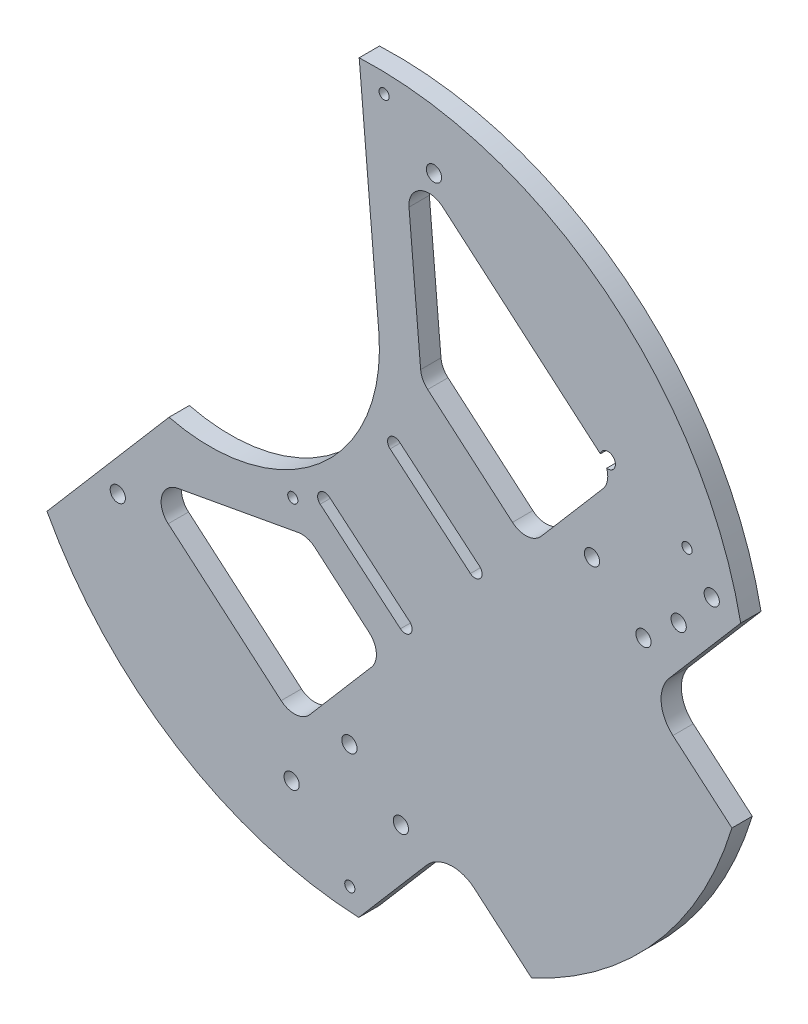
from build123d import *

# Parameters (mm, degrees)
SKETCH1_R                     = 2.25
BOSS_EXTRUDE1_DEPTH           = 6
CUT_EXTRUDE1_DEPTH            = 10
F_4_5_4_5_DIAMETER_HOLE_D     = 4.5
F_4_5_4_5_DIAMETER_HOLE_DEPTH = 10
F_4_5_4_5_DIAMETER_HOLE_TIP   = 1.351936393
F_3_0MM_DOWEL_HOLE1_D         = 3
SKETCH7_R                     = 2.25
CUT_EXTRUDE2_DEPTH            = 10


with BuildPart() as part:
    # Sketch1 → Boss-Extrude1 (new body)
    with BuildSketch(Plane.XY):
        with BuildLine():
            Line((-65.035663921, 1.711915562), (-29.013741643, 43.763540849))
            ThreePointArc((-29.013741643, 43.763540849), (15.528638535, 54.242344342), (32.891210684, 96.578735816))
            Line((32.891210684, 96.578735816), (27.098939814, 163.698257544))
            ThreePointArc((27.098939814, 163.698257544), (127.465162657, -0.583384608), (-65.035663921, 1.711915562))
        make_face()
        with Locations((-44.130722543, 16.588386381)):
            Circle(SKETCH1_R, mode=Mode.SUBTRACT)
        with Locations((7.160790579, -31.047531597)):
            Circle(SKETCH1_R, mode=Mode.SUBTRACT)
        with Locations((100.470270724, 97.551800763)):
            Circle(SKETCH1_R, mode=Mode.SUBTRACT)
        with Locations((49.178757602, 145.187718741)):
            Circle(SKETCH1_R, mode=Mode.SUBTRACT)
    extrude(amount=BOSS_EXTRUDE1_DEPTH)

    # Sketch2 → Cut-Extrude1 (cut)
    with BuildSketch(Plane.XY.offset(6)):
        with BuildLine():
            Line((59.918631336, 48.293162369), (36.232435894, 68.292265986))
            ThreePointArc((36.232435894, 68.292265986), (35.982665158, 71.251592696), (38.941991868, 71.501363433))
            Line((38.941991868, 71.501363433), (62.62818731, 51.502259816))
            ThreePointArc((62.62818731, 51.502259816), (62.877958047, 48.542933105), (59.918631336, 48.293162369))
        make_face()
        with BuildLine():
            Line((39.274395345, 23.842896106), (15.588199903, 43.841999723))
            ThreePointArc((15.588199903, 43.841999723), (15.338429166, 46.801326433), (18.297755877, 47.05109717))
            Line((18.297755877, 47.05109717), (41.983951319, 27.051993553))
            ThreePointArc((41.983951319, 27.051993553), (42.233722055, 24.092666842), (39.274395345, 23.842896106))
        make_face()
    extrude(amount=-CUT_EXTRUDE1_DEPTH, mode=Mode.SUBTRACT)

    # Ø4.5 (4.5) Diameter Hole
    with Locations(Plane(origin=(207.215806152, -96.41995806, 6), x_dir=(-0.6505588840958346, -0.7594558172296677, 0), z_dir=(0, 0, 1))):
        with Locations((80.500098125, -194.461558154), (77.690872648, -264.405165812), (-80.677949684, -277.202176468), (-77.868724207, -207.25856881)):
            Hole(F_4_5_4_5_DIAMETER_HOLE_D / 2, depth=F_4_5_4_5_DIAMETER_HOLE_DEPTH)
            with Locations((0, 0, -(F_4_5_4_5_DIAMETER_HOLE_DEPTH + F_4_5_4_5_DIAMETER_HOLE_TIP / 2))):  # 118° drill point
                Cone(0, F_4_5_4_5_DIAMETER_HOLE_D / 2, F_4_5_4_5_DIAMETER_HOLE_TIP, mode=Mode.SUBTRACT)

    # Ø3.0mm Dowel Hole1 (through all)
    with Locations(Plane(origin=(207.215806152, -96.41995806, 6), x_dir=(-0.6505588840958346, -0.7594558172296677, 0), z_dir=(0, 0, 1))):
        with Locations((-80.915811264, -296.794954316), (-84.945199209, -182.518931257), (25.216324899, -241.36407945), (83.328606401, -169.42446636)):
            Hole(F_3_0MM_DOWEL_HOLE1_D / 2)

    # Sketch7 → Cut-Extrude2 (cut)
    with BuildSketch(Plane.XY.offset(6)):
        with Locations((39.410270698, -26.198883172)):
            Circle(SKETCH7_R)
        with Locations((110.999824953, 57.374033532)):
            Circle(SKETCH7_R)
        with Locations((24.221154353, -13.187705491)):
            Circle(SKETCH7_R)
        with Locations((95.810708608, 70.385211214)):
            Circle(SKETCH7_R)
        with Locations((121.384198104, 66.422365269)):
            Circle(SKETCH7_R)
        with Locations((131.142581365, 77.814202528)):
            Circle(SKETCH7_R)
        with BuildLine():
            Line((41.803278919, 132.877815753), (45.238927943, 93.066293727))
            ThreePointArc((45.238927943, 93.066293727), (45.878980453, 90.841973142), (47.3133567, 89.025428603))
            Line((47.3133567, 89.025428603), (72.343619279, 67.584208031))
            ThreePointArc((72.343619279, 67.584208031), (76.708983142, 66.158757194), (80.803707486, 68.23758963))
            Line((80.803707486, 68.23758963), (99.019356241, 89.502352513))
            ThreePointArc((99.019356241, 89.502352513), (100.444807079, 93.867716376), (98.365974642, 97.962440721))
            Line((98.365974642, 97.962440721), (51.684414285, 137.950420436))
            ThreePointArc((51.684414285, 137.950420436), (45.040870616, 138.731415084), (41.803278919, 132.877815753))
        make_face()
        with BuildLine():
            Line((139.689194778, 75.494313025), (118.594383125, 50.868444691))
            ThreePointArc((118.594383125, 50.868444691), (116.218631729, 43.592838252), (119.683352457, 36.768297678))
            Line((119.683352457, 36.768297678), (137.105326674, 21.84442739))
            Line((137.105326674, 21.84442739), (157.179168696, 45.278426173))
            Line((157.179168696, 45.278426173), (139.689194778, 75.494313025))
        make_face()
        with BuildLine():
            Line((26.971727927, -56.090910074), (47.00482887, -32.704472013))
            ThreePointArc((47.00482887, -32.704472013), (53.829369443, -29.239751286), (61.104975883, -31.615502682))
            Line((61.104975883, -31.615502682), (77.970944185, -46.063091691))
            Line((77.970944185, -46.063091691), (19.420644617, -114.414115242))
            Line((19.420644617, -114.414115242), (26.971727927, -56.090910074))
        make_face()
        with BuildLine():
            Line((30.087133776, 18.254417116), (14.029920525, 32.009216931))
            ThreePointArc((14.029920525, 32.009216931), (11.691810194, 33.244719457), (9.049641572, 33.355043433))
            Line((9.049641572, 33.355043433), (-26.43283022, 26.881246492))
            ThreePointArc((-26.43283022, 26.881246492), (-31.148141999, 22.54392806), (-29.259257875, 16.421950183))
            Line((-29.259257875, 16.421950183), (4.064778412, -12.123815573))
            ThreePointArc((4.064778412, -12.123815573), (8.430142276, -13.549266411), (12.52486662, -11.470433974))
            Line((12.52486662, -11.470433974), (30.740515375, 9.794328908))
            ThreePointArc((30.740515375, 9.794328908), (32.165966213, 14.159692772), (30.087133776, 18.254417116))
        make_face()
    extrude(amount=-CUT_EXTRUDE2_DEPTH, mode=Mode.SUBTRACT)


solid = part.part
